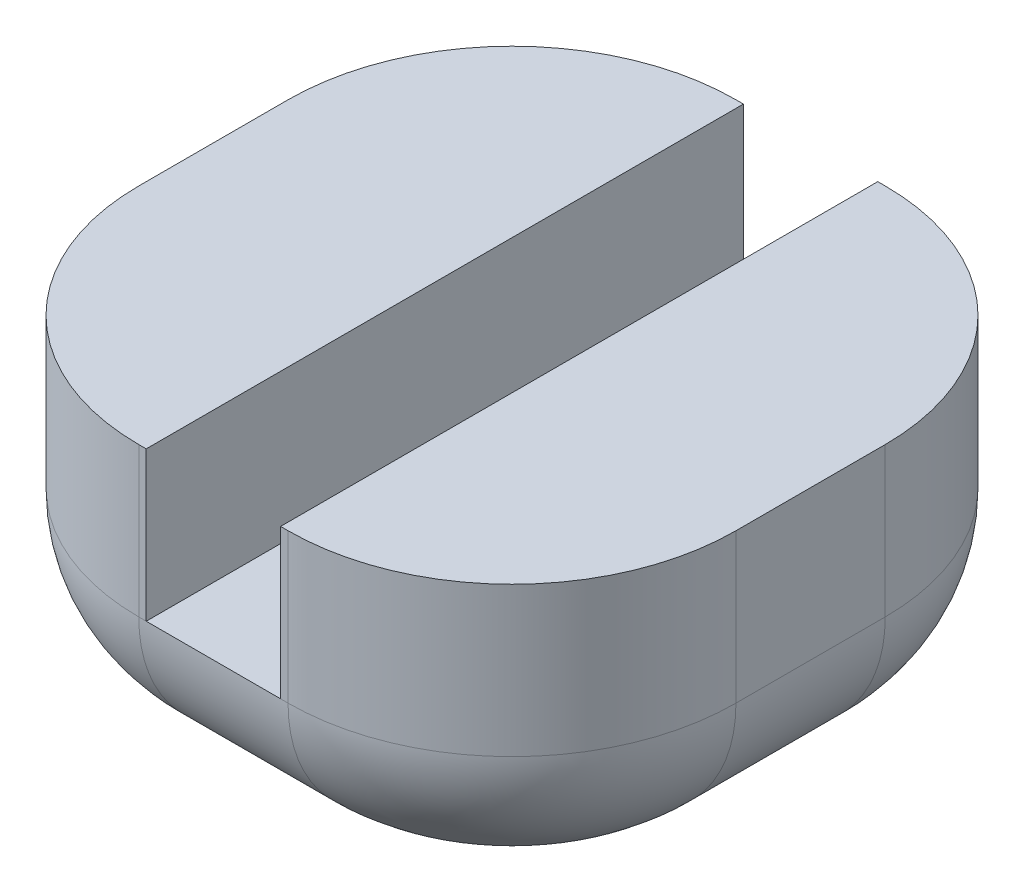
from build123d import *

# Parameters (mm, degrees)
SKETCH_1_W          = 4
SKETCH_1_H          = 4
EXTRUDE_1_DEPTH     = 2
FILLET_1_R          = 1.5
SKETCH_2_R          = 0.45
CUT_EXTRUDE_1_DEPTH = 4.464101615
SKETCH_3_W          = 0.9
SKETCH_3_H          = 4
CUT_EXTRUDE_2_DEPTH = 1
FILLET_3_R          = 1


with BuildPart() as part:
    # 草图1 → 凸台-拉伸1 (new body)
    with BuildSketch(Plane(origin=(0, 0, 0), x_dir=(1, 0, 0), z_dir=(0, 1, 0))):
        Rectangle(SKETCH_1_W, SKETCH_1_H)
    extrude(amount=EXTRUDE_1_DEPTH)

    # 圆角1
    fillet_1_edges = [part.edges().sort_by_distance(p)[0] for p in [
        (-2, 1, -2),
        (2, 1, -2),
        (2, 1, 2),
        (-2, 1, 2),
    ]]
    fillet(fillet_1_edges, radius=FILLET_1_R)

    # 草图2 → 切除-拉伸1 (cut, through all)
    with BuildSketch(Plane(origin=(0, 2, 0), x_dir=(1, 0, 0), z_dir=(0, 1, 0))):
        with Locations(Location((0, 0, 0), (0, 0, 270))):
            Circle(SKETCH_2_R)
    extrude(amount=-CUT_EXTRUDE_1_DEPTH, mode=Mode.SUBTRACT)

    # 草图3 → 切除-拉伸2 (cut)
    with BuildSketch(Plane(origin=(0, 2, 0), x_dir=(1, 0, 0), z_dir=(0, 1, 0))):
        Rectangle(SKETCH_3_W, SKETCH_3_H)
    extrude(amount=-CUT_EXTRUDE_2_DEPTH, mode=Mode.SUBTRACT)

    # 圆角3
    fillet_3_edges = [part.edges().sort_by_distance(p)[0] for p in [
        (-2, 0, 0),
        (0, 0, -2),
        (2, 0, 0),
        (0, 0, 2),
        (-1.560660172, 0, 1.560660172),
        (1.560660172, 0, 1.560660172),
        (1.560660172, 0, -1.560660172),
        (-1.560660172, 0, -1.560660172),
    ]]
    fillet(fillet_3_edges, radius=FILLET_3_R - 0.0001)  # a hair under: the kernel refuses the full size


solid = part.part
